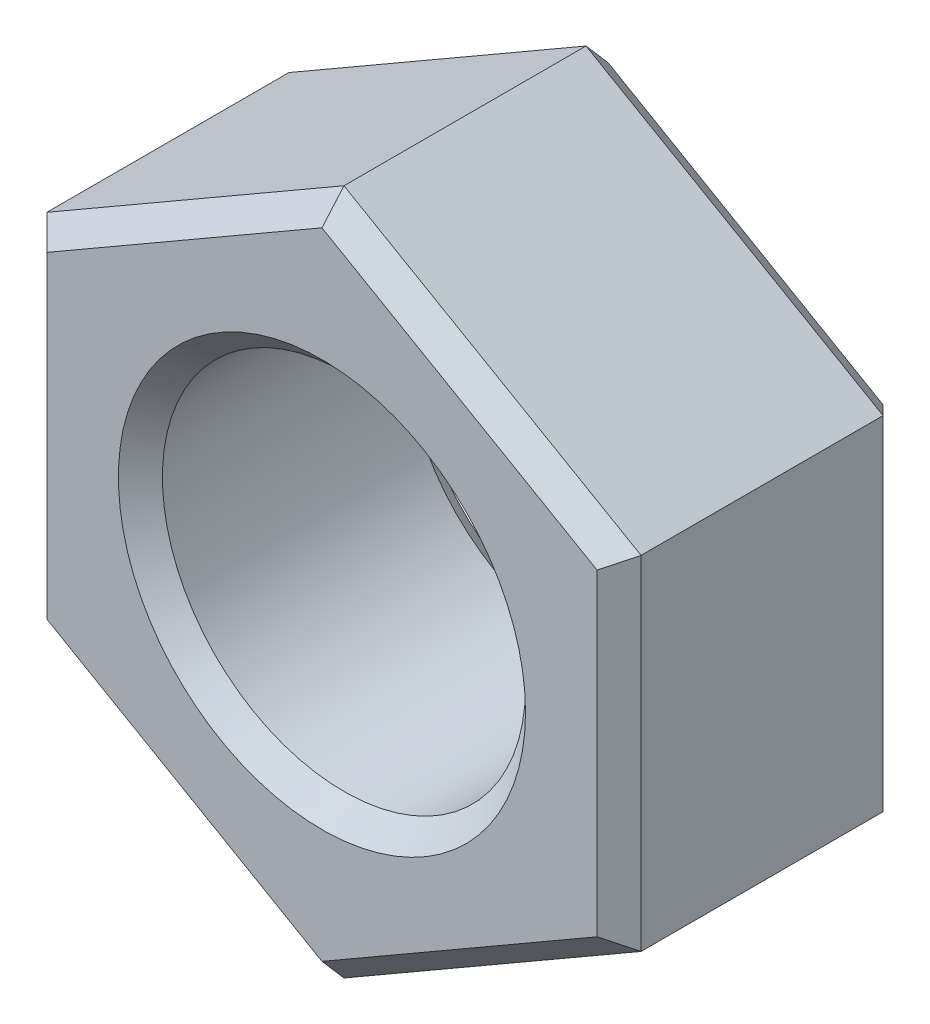
from build123d import *

# Parameters (mm, degrees)
SKETCH1_R           = 1.65
BOSS_EXTRUDE1_DEPTH = 1.3
DEBURS_SIZE         = 0.2


with BuildPart() as part:
    # Sketch1 → Boss-Extrude1 (new, symmetric)
    with BuildSketch(Plane.XY):
        Polygon((2.7, -1.558845727), (2.7, 1.558845727), (0, 3.117691454), (-2.7, 1.558845727), (-2.7, -1.558845727), (0, -3.117691454), align=None)
        Circle(SKETCH1_R, mode=Mode.SUBTRACT)
    extrude(amount=BOSS_EXTRUDE1_DEPTH, both=True)

    # Deburs
    deburs_edges = [part.edges().sort_by_distance(p)[0] for p in [
        (-1.65, 0, -1.3),
        (2.7, 0, -1.3),
        (1.35, 2.33826859, -1.3),
        (-1.35, 2.33826859, -1.3),
        (-2.7, 0, -1.3),
        (-1.35, -2.33826859, -1.3),
        (1.35, -2.33826859, -1.3),
        (-1.65, 0, 1.3),
        (-1.35, -2.33826859, 1.3),
        (-2.7, 0, 1.3),
        (-1.35, 2.33826859, 1.3),
        (1.35, 2.33826859, 1.3),
        (2.7, 0, 1.3),
        (1.35, -2.33826859, 1.3),
    ]]
    chamfer(deburs_edges, length=DEBURS_SIZE)


solid = part.part
